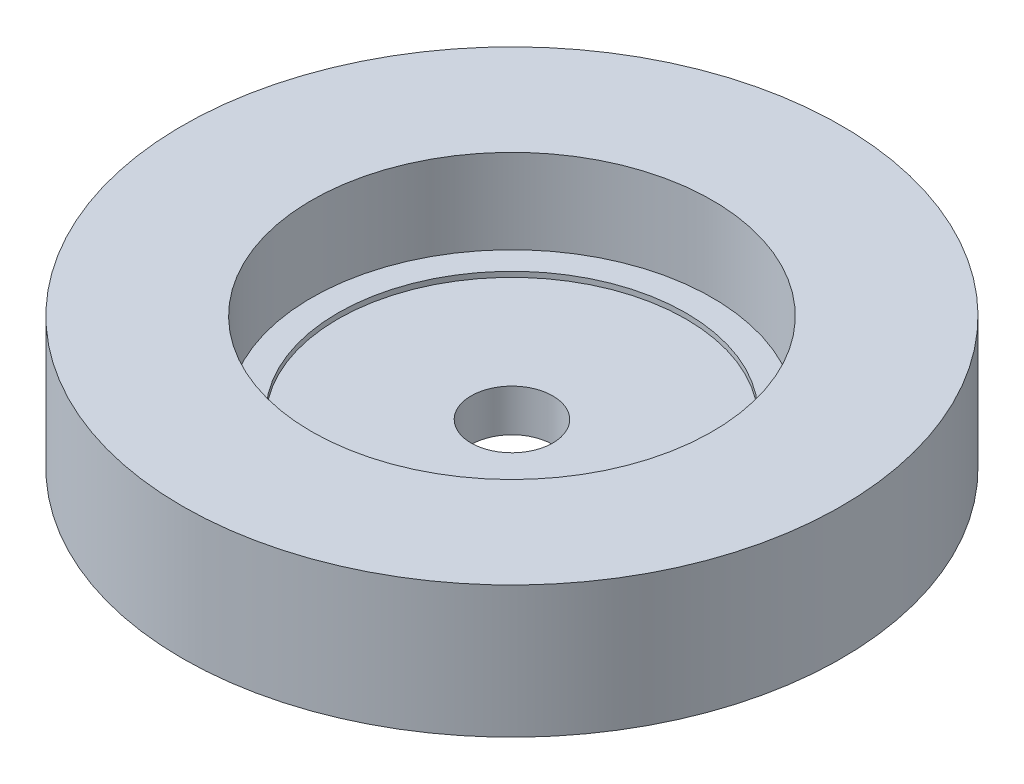
from build123d import *

# Parameters (mm, degrees)
SKETCH_1_R      = 12.5
SKETCH_1_R_2    = 7.6
EXTRUDE_1_DEPTH = 5
SKETCH_2_R      = 7.6
SKETCH_2_R_2    = 1.55
EXTRUDE_2_DEPTH = 1.6
SKETCH_3_R      = 7.6
SKETCH_3_R_2    = 6.6
EXTRUDE_3_DEPTH = 0.2


with BuildPart() as part:
    # ｽｹｯﾁ1 → ﾎﾞｽ - 押し出し1 (new body)
    with BuildSketch(Plane(origin=(0, 0, 0), x_dir=(1, 0, 0), z_dir=(0, 1, 0))):
        Circle(SKETCH_1_R)
        Circle(SKETCH_1_R_2, mode=Mode.SUBTRACT)
    extrude(amount=EXTRUDE_1_DEPTH)

    # ｽｹｯﾁ2 → ﾎﾞｽ - 押し出し2 (add)
    with BuildSketch(Plane.XZ):
        Circle(SKETCH_2_R)
        Circle(SKETCH_2_R_2, mode=Mode.SUBTRACT)
    extrude(amount=-EXTRUDE_2_DEPTH)

    # ｽｹｯﾁ3 → ﾎﾞｽ - 押し出し3 (add)
    with BuildSketch(Plane(origin=(0, 1.6, 0), x_dir=(1, 0, 0), z_dir=(0, 1, 0))):
        Circle(SKETCH_3_R)
        Circle(SKETCH_3_R_2, mode=Mode.SUBTRACT)
    extrude(amount=EXTRUDE_3_DEPTH)


solid = part.part
